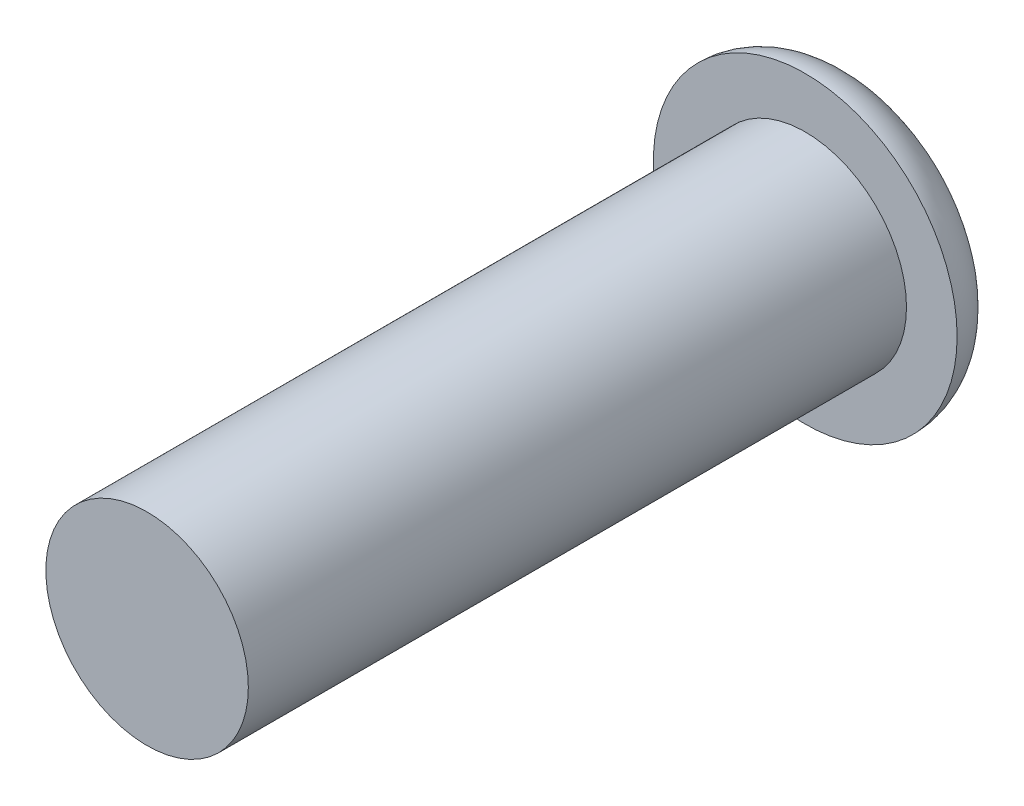
from build123d import *

# Parameters (mm, degrees)
SKETCH1_R           = 15
BOSS_EXTRUDE1_DEPTH = 5
SKETCH2_R           = 10
BOSS_EXTRUDE2_DEPTH = 65
FILLET1_R           = 5


with BuildPart() as part:
    # Sketch1 → Boss-Extrude1 (new body)
    with BuildSketch(Plane.XY):
        Circle(SKETCH1_R)
    extrude(amount=BOSS_EXTRUDE1_DEPTH)

    # Sketch2 → Boss-Extrude2 (add)
    with BuildSketch(Plane.XY.offset(5)):
        Circle(SKETCH2_R)
    extrude(amount=BOSS_EXTRUDE2_DEPTH)

    # Fillet1
    fillet1_edges = [part.edges().sort_by_distance(p)[0] for p in [
        (-15, 0, 0),
    ]]
    fillet(fillet1_edges, radius=FILLET1_R - 0.0001)  # a hair under: the kernel refuses the full size


solid = part.part
